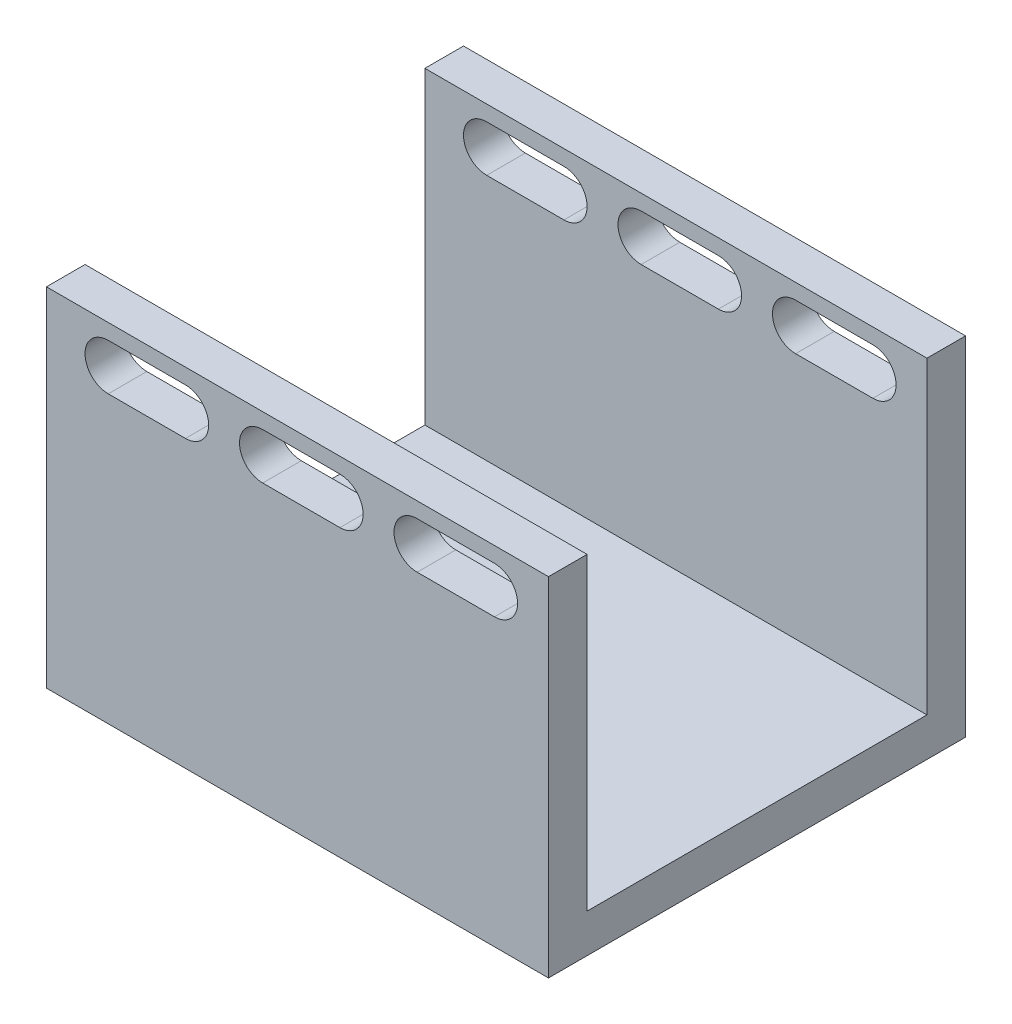
from build123d import *

# Parameters (mm, degrees)
SKETCH1_W           = 65
SKETCH1_H           = 44
BOSS_EXTRUDE1_DEPTH = 5
SKETCH2_W           = 65
SKETCH2_H           = 5
BOSS_EXTRUDE2_DEPTH = 45
CUT_EXTRUDE1_DEPTH  = 78.441913716


with BuildPart() as part:
    # Sketch1 → Boss-Extrude1 (new body)
    with BuildSketch(Plane(origin=(0, 0, 0), x_dir=(1, 0, 0), z_dir=(0, 1, 0))):
        Rectangle(SKETCH1_W, SKETCH1_H)
    extrude(amount=BOSS_EXTRUDE1_DEPTH)

    # Sketch2 → Boss-Extrude2 (add)
    with BuildSketch(Plane(origin=(0, 0, 0), x_dir=(1, 0, 0), z_dir=(0, 1, 0))):
        with Locations((0, -24.5)):
            Rectangle(SKETCH2_W, SKETCH2_H)
        with Locations((0, 24.5)):
            Rectangle(SKETCH2_W, SKETCH2_H)
    extrude(amount=BOSS_EXTRUDE2_DEPTH)

    # Sketch3 → Cut-Extrude1 (cut, through all)
    with BuildSketch(Plane.XY.offset(27)):
        with BuildLine():
            Line((-14.5, 43), (-24.5, 43))
            ThreePointArc((-24.5, 43), (-27.5, 40), (-24.5, 37))
            Line((-24.5, 37), (-14.5, 37))
            ThreePointArc((-14.5, 37), (-11.5, 40), (-14.5, 43))
        make_face()
        with BuildLine():
            ThreePointArc((-4.5, 43), (-7.5, 40), (-4.5, 37))
            Line((-4.5, 37), (5.5, 37))
            ThreePointArc((5.5, 37), (8.5, 40), (5.5, 43))
            Line((5.5, 43), (-4.5, 43))
        make_face()
        with BuildLine():
            ThreePointArc((15.5, 43), (12.5, 40), (15.5, 37))
            Line((15.5, 37), (25.5, 37))
            ThreePointArc((25.5, 37), (28.5, 40), (25.5, 43))
            Line((25.5, 43), (15.5, 43))
        make_face()
    extrude(amount=-CUT_EXTRUDE1_DEPTH, mode=Mode.SUBTRACT)


solid = part.part
